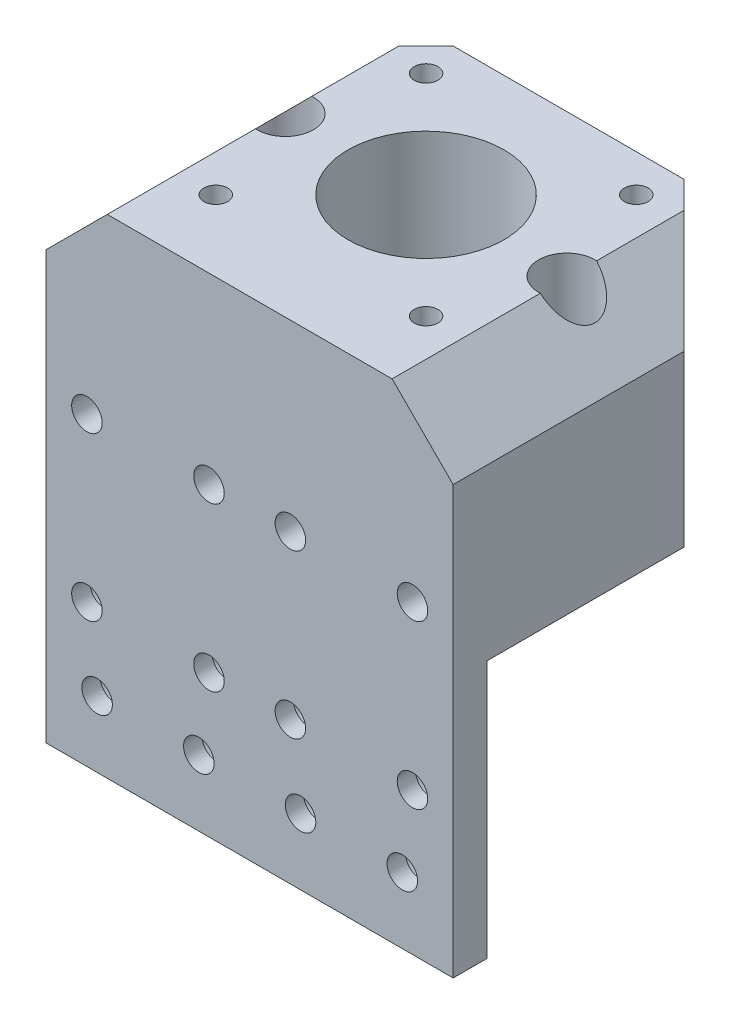
from build123d import *

# Parameters (mm, degrees)
SKETCH2_W           = 5
SKETCH2_H           = 50
BOSS_EXTRUDE1_DEPTH = 30
CUT_EXTRUDE1_REACH  = 66.607
SKETCH3_R           = 2.25
SKETCH6_W           = 47
SKETCH6_H           = 34
BOSS_EXTRUDE3_DEPTH = 60
SKETCH7_R           = 4
CUT_EXTRUDE2_DEPTH  = 2.3
CUT_EXTRUDE3_REACH  = 77.168
SKETCH8_R           = 11.5
SKETCH8_R_2         = 4.15
SKETCH8_R_3         = 1.75
CHAMFER1_SIZE       = 13
SKETCH9_R           = 3
CUT_EXTRUDE4_DEPTH  = 17
CHAMFER2_SIZE       = 9
SKETCH3_2_R         = 2.25
CUT_EXTRUDE5_DEPTH  = 5


with BuildPart() as part:
    # Sketch2 → Boss-Extrude1 (new, symmetric)
    with BuildSketch(Plane(origin=(0, 0, 0), x_dir=(0, 0, -1), z_dir=(1, 0, 0))):
        with Locations((13, 32)):
            Rectangle(SKETCH2_W, SKETCH2_H)
    extrude(amount=BOSS_EXTRUDE1_DEPTH, both=True)

    # Sketch3 → Cut-Extrude1 (cut, up to next)
    with BuildSketch(Plane.XY.offset(-10.5), mode=Mode.PRIVATE) as cut_extrude1_sk1:
        with Locations((-22.5, 16.75)):
            Circle(SKETCH3_R)
    cut_extrude1_tool1 = extrude(cut_extrude1_sk1.sketch, amount=-CUT_EXTRUDE1_REACH, mode=Mode.PRIVATE) & part.part
    # Sketch3 → Cut-Extrude1 (cut, up to next)
    with BuildSketch(Plane.XY.offset(-10.5), mode=Mode.PRIVATE) as cut_extrude1_sk2:
        with Locations((-7.5, 16.75)):
            Circle(SKETCH3_R)
    cut_extrude1_tool2 = extrude(cut_extrude1_sk2.sketch, amount=-CUT_EXTRUDE1_REACH, mode=Mode.PRIVATE) & part.part
    # Sketch3 → Cut-Extrude1 (cut, up to next)
    with BuildSketch(Plane.XY.offset(-10.5), mode=Mode.PRIVATE) as cut_extrude1_sk3:
        with Locations((7.5, 16.75)):
            Circle(SKETCH3_R)
    cut_extrude1_tool3 = extrude(cut_extrude1_sk3.sketch, amount=-CUT_EXTRUDE1_REACH, mode=Mode.PRIVATE) & part.part
    # Sketch3 → Cut-Extrude1 (cut, up to next)
    with BuildSketch(Plane.XY.offset(-10.5), mode=Mode.PRIVATE) as cut_extrude1_sk4:
        with Locations((22.5, 16.75)):
            Circle(SKETCH3_R)
    cut_extrude1_tool4 = extrude(cut_extrude1_sk4.sketch, amount=-CUT_EXTRUDE1_REACH, mode=Mode.PRIVATE) & part.part
    # Sketch3 → Cut-Extrude1 (cut, up to next)
    with BuildSketch(Plane.XY.offset(-10.5), mode=Mode.PRIVATE) as cut_extrude1_sk5:
        with Locations((-24, 52)):
            Circle(SKETCH3_R)
    cut_extrude1_tool5 = extrude(cut_extrude1_sk5.sketch, amount=-CUT_EXTRUDE1_REACH, mode=Mode.PRIVATE) & part.part
    # Sketch3 → Cut-Extrude1 (cut, up to next)
    with BuildSketch(Plane.XY.offset(-10.5), mode=Mode.PRIVATE) as cut_extrude1_sk6:
        with Locations((-6, 52)):
            Circle(SKETCH3_R)
    cut_extrude1_tool6 = extrude(cut_extrude1_sk6.sketch, amount=-CUT_EXTRUDE1_REACH, mode=Mode.PRIVATE) & part.part
    # Sketch3 → Cut-Extrude1 (cut, up to next)
    with BuildSketch(Plane.XY.offset(-10.5), mode=Mode.PRIVATE) as cut_extrude1_sk7:
        with Locations((-24, 28)):
            Circle(SKETCH3_R)
    cut_extrude1_tool7 = extrude(cut_extrude1_sk7.sketch, amount=-CUT_EXTRUDE1_REACH, mode=Mode.PRIVATE) & part.part
    # Sketch3 → Cut-Extrude1 (cut, up to next)
    with BuildSketch(Plane.XY.offset(-10.5), mode=Mode.PRIVATE) as cut_extrude1_sk8:
        with Locations((-6, 28)):
            Circle(SKETCH3_R)
    cut_extrude1_tool8 = extrude(cut_extrude1_sk8.sketch, amount=-CUT_EXTRUDE1_REACH, mode=Mode.PRIVATE) & part.part
    # Sketch3 → Cut-Extrude1 (cut, up to next)
    with BuildSketch(Plane.XY.offset(-10.5), mode=Mode.PRIVATE) as cut_extrude1_sk9:
        with Locations(Location((6, 28, 0), (0, 0, 90))):
            Circle(SKETCH3_R)
    cut_extrude1_tool9 = extrude(cut_extrude1_sk9.sketch, amount=-CUT_EXTRUDE1_REACH, mode=Mode.PRIVATE) & part.part
    # Sketch3 → Cut-Extrude1 (cut, up to next)
    with BuildSketch(Plane.XY.offset(-10.5), mode=Mode.PRIVATE) as cut_extrude1_sk10:
        with Locations(Location((24, 28, 0), (0, 0, 90))):
            Circle(SKETCH3_R)
    cut_extrude1_tool10 = extrude(cut_extrude1_sk10.sketch, amount=-CUT_EXTRUDE1_REACH, mode=Mode.PRIVATE) & part.part
    # Sketch3 → Cut-Extrude1 (cut, up to next)
    with BuildSketch(Plane.XY.offset(-10.5), mode=Mode.PRIVATE) as cut_extrude1_sk11:
        with Locations(Location((6, 52, 0), (0, 0, 90))):
            Circle(SKETCH3_R)
    cut_extrude1_tool11 = extrude(cut_extrude1_sk11.sketch, amount=-CUT_EXTRUDE1_REACH, mode=Mode.PRIVATE) & part.part
    # Sketch3 → Cut-Extrude1 (cut, up to next)
    with BuildSketch(Plane.XY.offset(-10.5), mode=Mode.PRIVATE) as cut_extrude1_sk12:
        with Locations(Location((24, 52, 0), (0, 0, 90))):
            Circle(SKETCH3_R)
    cut_extrude1_tool12 = extrude(cut_extrude1_sk12.sketch, amount=-CUT_EXTRUDE1_REACH, mode=Mode.PRIVATE) & part.part
    add(cut_extrude1_tool1.solids().sort_by_distance((-22.5, 16.75, -10.5))[0], mode=Mode.SUBTRACT)
    add(cut_extrude1_tool2.solids().sort_by_distance((-7.5, 16.75, -10.5))[0], mode=Mode.SUBTRACT)
    add(cut_extrude1_tool3.solids().sort_by_distance((7.5, 16.75, -10.5))[0], mode=Mode.SUBTRACT)
    add(cut_extrude1_tool4.solids().sort_by_distance((22.5, 16.75, -10.5))[0], mode=Mode.SUBTRACT)
    add(cut_extrude1_tool5.solids().sort_by_distance((-24, 52, -10.5))[0], mode=Mode.SUBTRACT)
    add(cut_extrude1_tool6.solids().sort_by_distance((-6, 52, -10.5))[0], mode=Mode.SUBTRACT)
    add(cut_extrude1_tool7.solids().sort_by_distance((-24, 28, -10.5))[0], mode=Mode.SUBTRACT)
    add(cut_extrude1_tool8.solids().sort_by_distance((-6, 28, -10.5))[0], mode=Mode.SUBTRACT)
    add(cut_extrude1_tool9.solids().sort_by_distance((6, 28, -10.5))[0], mode=Mode.SUBTRACT)
    add(cut_extrude1_tool10.solids().sort_by_distance((24, 28, -10.5))[0], mode=Mode.SUBTRACT)
    add(cut_extrude1_tool11.solids().sort_by_distance((6, 52, -10.5))[0], mode=Mode.SUBTRACT)
    add(cut_extrude1_tool12.solids().sort_by_distance((24, 52, -10.5))[0], mode=Mode.SUBTRACT)

    # Sketch6 → Boss-Extrude3 (add)
    with BuildSketch(Plane(origin=(30, 0, 0), x_dir=(0, 0, -1), z_dir=(1, 0, 0))):
        with Locations((34, 62)):
            Rectangle(SKETCH6_W, SKETCH6_H)
    extrude(amount=-BOSS_EXTRUDE3_DEPTH)

    # Sketch7 → Cut-Extrude2 (cut)
    with BuildSketch(Plane(origin=(0, 0, -15.5), x_dir=(-1, 0, 0), z_dir=(0, 0, -1))):
        with Locations(Location((22.5, 16.75, 0), (0, 0, 90))):
            Circle(SKETCH7_R)
        with Locations(Location((24, 28, 0), (0, 0, 90))):
            Circle(SKETCH7_R)
        with Locations(Location((7.5, 16.75, 0), (0, 0, 90))):
            Circle(SKETCH7_R)
        with Locations(Location((-7.5, 16.75, 0), (0, 0, 90))):
            Circle(SKETCH7_R)
        with Locations(Location((-22.5, 16.75, 0), (0, 0, 90))):
            Circle(SKETCH7_R)
        with Locations(Location((6, 28, 0), (0, 0, 90))):
            Circle(SKETCH7_R)
        with Locations(Location((-6, 28, 0), (0, 0, 270))):
            Circle(SKETCH7_R)
        with Locations(Location((-24, 28, 0), (0, 0, 270))):
            Circle(SKETCH7_R)
    extrude(amount=-CUT_EXTRUDE2_DEPTH, mode=Mode.SUBTRACT)

    # Sketch8 → Cut-Extrude3 (cut, up to next)
    with BuildSketch(Plane.XZ.offset(-45), mode=Mode.PRIVATE) as cut_extrude3_sk1:
        with Locations(Location((0, -36.5, 0), (0, 0, 270))):
            Circle(SKETCH8_R)
    cut_extrude3_tool1 = extrude(cut_extrude3_sk1.sketch, amount=-CUT_EXTRUDE3_REACH, mode=Mode.PRIVATE) & part.part
    # Sketch8 → Cut-Extrude3 (cut, up to next)
    with BuildSketch(Plane.XZ.offset(-45), mode=Mode.PRIVATE) as cut_extrude3_sk2:
        with Locations(Location((-20.75, -36.5, 0), (0, 0, 270))):
            Circle(SKETCH8_R_2)
    cut_extrude3_tool2 = extrude(cut_extrude3_sk2.sketch, amount=-CUT_EXTRUDE3_REACH, mode=Mode.PRIVATE) & part.part
    # Sketch8 → Cut-Extrude3 (cut, up to next)
    with BuildSketch(Plane.XZ.offset(-45), mode=Mode.PRIVATE) as cut_extrude3_sk3:
        with Locations(Location((20.75, -36.5, 0), (0, 0, 90))):
            Circle(SKETCH8_R_2)
    cut_extrude3_tool3 = extrude(cut_extrude3_sk3.sketch, amount=-CUT_EXTRUDE3_REACH, mode=Mode.PRIVATE) & part.part
    # Sketch8 → Cut-Extrude3 (cut, up to next)
    with BuildSketch(Plane.XZ.offset(-45), mode=Mode.PRIVATE) as cut_extrude3_sk4:
        with Locations(Location((-15.5, -52, 0), (0, 0, 270))):
            Circle(SKETCH8_R_3)
    cut_extrude3_tool4 = extrude(cut_extrude3_sk4.sketch, amount=-CUT_EXTRUDE3_REACH, mode=Mode.PRIVATE) & part.part
    # Sketch8 → Cut-Extrude3 (cut, up to next)
    with BuildSketch(Plane.XZ.offset(-45), mode=Mode.PRIVATE) as cut_extrude3_sk5:
        with Locations(Location((15.5, -52, 0), (0, 0, 90))):
            Circle(SKETCH8_R_3)
    cut_extrude3_tool5 = extrude(cut_extrude3_sk5.sketch, amount=-CUT_EXTRUDE3_REACH, mode=Mode.PRIVATE) & part.part
    # Sketch8 → Cut-Extrude3 (cut, up to next)
    with BuildSketch(Plane.XZ.offset(-45), mode=Mode.PRIVATE) as cut_extrude3_sk6:
        with Locations(Location((15.5, -21, 0), (0, 0, 270))):
            Circle(SKETCH8_R_3)
    cut_extrude3_tool6 = extrude(cut_extrude3_sk6.sketch, amount=-CUT_EXTRUDE3_REACH, mode=Mode.PRIVATE) & part.part
    # Sketch8 → Cut-Extrude3 (cut, up to next)
    with BuildSketch(Plane.XZ.offset(-45), mode=Mode.PRIVATE) as cut_extrude3_sk7:
        with Locations(Location((-15.5, -21, 0), (0, 0, 90))):
            Circle(SKETCH8_R_3)
    cut_extrude3_tool7 = extrude(cut_extrude3_sk7.sketch, amount=-CUT_EXTRUDE3_REACH, mode=Mode.PRIVATE) & part.part
    add(cut_extrude3_tool1.solids().sort_by_distance((0, 45, -36.5))[0], mode=Mode.SUBTRACT)
    add(cut_extrude3_tool2.solids().sort_by_distance((-20.75, 45, -36.5))[0], mode=Mode.SUBTRACT)
    add(cut_extrude3_tool3.solids().sort_by_distance((20.75, 45, -36.5))[0], mode=Mode.SUBTRACT)
    add(cut_extrude3_tool4.solids().sort_by_distance((-15.5, 45, -52))[0], mode=Mode.SUBTRACT)
    add(cut_extrude3_tool5.solids().sort_by_distance((15.5, 45, -52))[0], mode=Mode.SUBTRACT)
    add(cut_extrude3_tool6.solids().sort_by_distance((15.5, 45, -21))[0], mode=Mode.SUBTRACT)
    add(cut_extrude3_tool7.solids().sort_by_distance((-15.5, 45, -21))[0], mode=Mode.SUBTRACT)

    # Chamfer1
    chamfer1_edges = [part.edges().sort_by_distance(p)[0] for p in [
        (30, 62, -57.5),
        (-30, 62, -57.5),
    ]]
    chamfer(chamfer1_edges, length=CHAMFER1_SIZE)

    # Sketch9 → Cut-Extrude4 (cut)
    with BuildSketch(Plane.XZ.offset(-45)):
        with Locations(Location((-15.5, -21, 0), (0, 0, 270))):
            Circle(SKETCH9_R)
        with Locations(Location((-15.5, -52, 0), (0, 0, 270))):
            Circle(SKETCH9_R)
        with Locations(Location((15.5, -52, 0), (0, 0, 90))):
            Circle(SKETCH9_R)
        with Locations(Location((15.5, -21, 0), (0, 0, 90))):
            Circle(SKETCH9_R)
    extrude(amount=-CUT_EXTRUDE4_DEPTH, mode=Mode.SUBTRACT)

    # Chamfer2
    # the kernel refuses this chamfer: 9 mm, written as the material it takes off along each edge
    with BuildSketch(Plane(origin=(30, 79, -67.645146892), x_dir=(-0.9996219169112966, 0.027495876610586775, 0), z_dir=(0, 0, 1)), Plane(origin=(-30, 79, -67.645146892), x_dir=(-0.027495876610586386, -0.9996219169112969, 0), z_dir=(0, 0, 1))) as chamfer2_piece_1:
        Polygon((CHAMFER2_SIZE * 0.999621916911, CHAMFER2_SIZE * 0.0274958766106), (-CHAMFER2_SIZE * 0.0274958766106, CHAMFER2_SIZE * 0.999621916911), (0, 0), align=None)
    extrude(amount=80.290293783, mode=Mode.SUBTRACT)

    # Sketch3<2> → Cut-Extrude5 (cut)
    with BuildSketch(Plane.XY.offset(-10.5)):
        with Locations((-22.5, 16.75)):
            Circle(SKETCH3_2_R)
        with Locations((-7.5, 16.75)):
            Circle(SKETCH3_2_R)
        with Locations((7.5, 16.75)):
            Circle(SKETCH3_2_R)
        with Locations((22.5, 16.75)):
            Circle(SKETCH3_2_R)
        with Locations((-24, 52)):
            Circle(SKETCH3_2_R)
        with Locations((-6, 52)):
            Circle(SKETCH3_2_R)
        with Locations((-24, 28)):
            Circle(SKETCH3_2_R)
        with Locations((-6, 28)):
            Circle(SKETCH3_2_R)
        with Locations(Location((6, 28, 0), (0, 0, 270))):
            Circle(SKETCH3_2_R)
        with Locations(Location((24, 28, 0), (0, 0, 270))):
            Circle(SKETCH3_2_R)
        with Locations(Location((6, 52, 0), (0, 0, 90))):
            Circle(SKETCH3_2_R)
        with Locations(Location((24, 52, 0), (0, 0, 90))):
            Circle(SKETCH3_2_R)
    extrude(amount=-CUT_EXTRUDE5_DEPTH, mode=Mode.SUBTRACT)


solid = part.part
